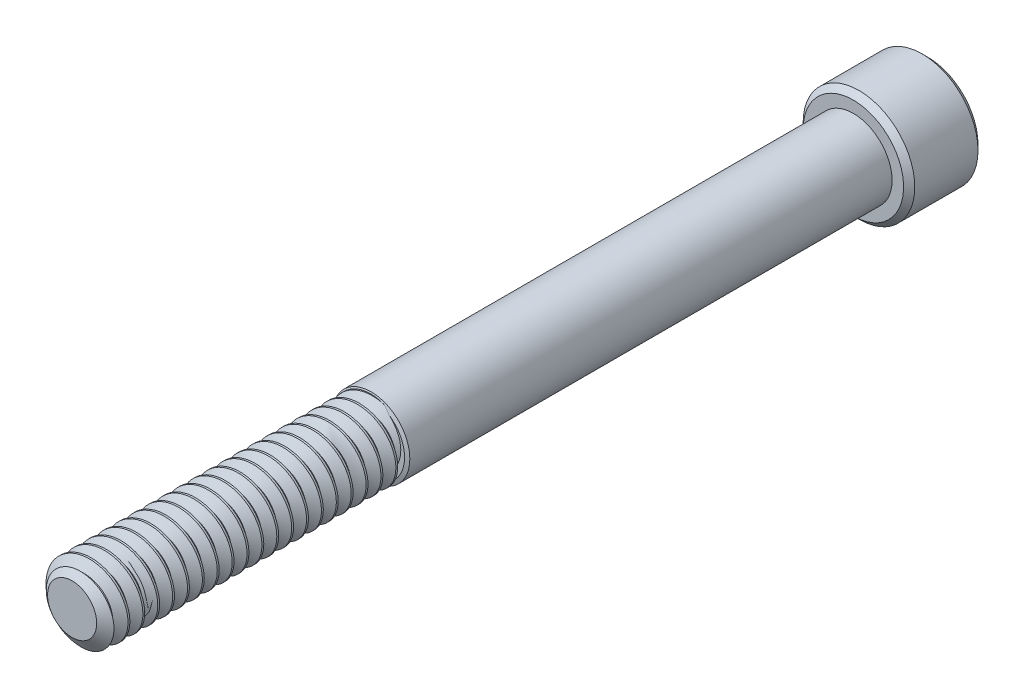
from build123d import *

# Parameters (mm, degrees)
SKETCH1_R          = 3.175
EXTRUDE1_DEPTH     = 66.675
CUT_SWEEP1_PITCH   = 1.27
SKETCH6_R          = 4.7625
EXTRUDE2_DEPTH     = 6.35
CUT_EXTRUDE1_DEPTH = 3.571875
CHAMFER1_SIZE      = 0.47625


with BuildPart() as part:
    # Sketch1 → Extrude1 (new body)
    with BuildSketch(Plane.XY):
        Circle(SKETCH1_R)
    extrude(amount=-EXTRUDE1_DEPTH)

    # Cut-Sweep1: the profile of Sketch3 profile screwed along a right-hand helix of 53.5 turns, 6 arcs to a turn; built about Z, then put on its axis
    cut_sweep1_z = Axis((0, 0, 0), (0, 0, 1))
    cut_sweep1_corners = [(3.1753, 0, -1.111423205), (2.350110803, 0, -0.635), (2.350110803, 0, -0.47625), (3.1753, 0, 0.000173205)]
    with BuildLine(mode=Mode.PRIVATE) as cut_sweep1_profile:
        Line(cut_sweep1_corners[0], cut_sweep1_corners[1])
        Line(cut_sweep1_corners[1], cut_sweep1_corners[2])
        Line(cut_sweep1_corners[2], cut_sweep1_corners[3])
        Line(cut_sweep1_corners[3], cut_sweep1_corners[0])
    cut_sweep1_cap = Face(cut_sweep1_profile.wire())
    cut_sweep1_turn_angles = [0, 30, 60, 90, 120, 150, 180, 210, 240, 270, 300, 330, 360, 390, 420, 450, 480, 510, 540, 570, 600, 630, 660, 690, 720]
    cut_sweep1_turn_weights = [1, 0.8660254037844387, 1, 0.8660254037844387, 1, 0.8660254037844387, 1, 0.8660254037844387, 1, 0.8660254037844387, 1, 0.8660254037844387, 1, 0.8660254037844387, 1, 0.8660254037844387, 1, 0.8660254037844387, 1, 0.8660254037844387, 1, 0.8660254037844387, 1, 0.8660254037844387, 1]
    cut_sweep1_turn_rails = [Edge.make_bspline([Vector(p[0], p[1], 0).rotate(cut_sweep1_z, cut_sweep1_turn_angles[k]) / cut_sweep1_turn_weights[k] + Vector(0, 0, p[2] + CUT_SWEEP1_PITCH * cut_sweep1_turn_angles[k] / 360) for k in range(25)], [0, 0, 0, 1, 1, 2, 2, 3, 3, 4, 4, 5, 5, 6, 6, 7, 7, 8, 8, 9, 9, 10, 10, 11, 11, 12, 12, 12], 2, cut_sweep1_turn_weights) for p in cut_sweep1_corners]
    cut_sweep1_turn_sides = [Face.make_surface_from_curves(cut_sweep1_turn_rails[p[0]], cut_sweep1_turn_rails[p[1]]) for p in [(0, 1), (1, 2), (2, 3), (3, 0)]]
    cut_sweep1_last_angles = [18720, 18750, 18780, 18810, 18840, 18870, 18900, 18930, 18960, 18990, 19020, 19050, 19080, 19110, 19140, 19170, 19200, 19230, 19260]
    cut_sweep1_last_weights = [1, 0.8660254037844387, 1, 0.8660254037844387, 1, 0.8660254037844387, 1, 0.8660254037844387, 1, 0.8660254037844387, 1, 0.8660254037844387, 1, 0.8660254037844387, 1, 0.8660254037844387, 1, 0.8660254037844228, 1]
    cut_sweep1_last_rails = [Edge.make_bspline([Vector(p[0], p[1], 0).rotate(cut_sweep1_z, cut_sweep1_last_angles[k]) / cut_sweep1_last_weights[k] + Vector(0, 0, p[2] + CUT_SWEEP1_PITCH * cut_sweep1_last_angles[k] / 360) for k in range(19)], [0, 0, 0, 1, 1, 2, 2, 3, 3, 4, 4, 5, 5, 6, 6, 7, 7, 8, 8, 9, 9, 9], 2, cut_sweep1_last_weights) for p in cut_sweep1_corners]
    cut_sweep1_last_sides = [Face.make_surface_from_curves(cut_sweep1_last_rails[p[0]], cut_sweep1_last_rails[p[1]]) for p in [(0, 1), (1, 2), (2, 3), (3, 0)]]
    cut_sweep1 = Plane(origin=(0, 0, 0), x_dir=(0, 1, 0), z_dir=(0, 0, -1)) * Solid(Shell([*[p.moved(Location((0, 0, 2 * CUT_SWEEP1_PITCH * i))) for i in range(26) for p in cut_sweep1_turn_sides], *cut_sweep1_last_sides, cut_sweep1_cap, cut_sweep1_cap.rotate(cut_sweep1_z, 19260).moved(Location((0, 0, CUT_SWEEP1_PITCH * 19260 / 360)))]))
    add(cut_sweep1, mode=Mode.SUBTRACT)

    # Sketch4 → Cut-Revolve1 (revolve, cut)
    with BuildSketch(Plane(origin=(0, 0, 0), x_dir=(0, 0, -1), z_dir=(1, 0, 0)), mode=Mode.PRIVATE) as cut_revolve1_sk:
        Polygon((0.755446349, 3.175), (0, 2.096110803), (0, 3.175), align=None)
    revolve(cut_revolve1_sk.sketch.rotate(Axis((0, 0, 0), (0, 0, -1)), 90), axis=Axis((0, 0, 0), (0, 0, -1)), mode=Mode.SUBTRACT)

    # Sketch5 → partially thread (revolve)
    with BuildSketch(Plane(origin=(0, 0, 0), x_dir=(0, 0, -1), z_dir=(1, 0, 0)), mode=Mode.PRIVATE) as partially_thread_sk:
        Polygon((66.675, 3.302), (25.520182971, 3.302), (25.4, 2.9718), (25.4, 0), (66.675, 0), align=None)
    revolve(partially_thread_sk.sketch.rotate(Axis((0, 0, 0), (0, 0, -1)), 90), axis=Axis((0, 0, 0), (0, 0, -1)))

    # Sketch6 → Extrude2 (add)
    with BuildSketch(Plane(origin=(0, 0, -66.675), x_dir=(-1, 0, 0), z_dir=(0, 0, -1))):
        with Locations(Location((0, 0, 0), (0, 0, 180))):
            Circle(SKETCH6_R)
    extrude(amount=EXTRUDE2_DEPTH)

    # Sketch7 → Cut-Extrude1 (cut)
    with BuildSketch(Plane(origin=(0, 0, -73.025), x_dir=(-1, 0, 0), z_dir=(0, 0, -1))):
        Polygon((0, 2.749630657), (-2.38125, 1.374815329), (-2.38125, -1.374815329), (0, -2.749630657), (2.38125, -1.374815329), (2.38125, 1.374815329), align=None)
    extrude(amount=-CUT_EXTRUDE1_DEPTH, mode=Mode.SUBTRACT)

    # Cut-Extrude2 cone 1 section (through the dimple's axis) → Cut-Extrude2 (revolve, cut)
    with BuildSketch(Plane(origin=(0, 0, -73.025), x_dir=(0, 1, 0), z_dir=(1, 0, 0))):
        Polygon((0, 0), (2.749630657, 0), (0, 2.749630657), align=None)
    revolve(axis=Axis((0, 0, -73.025), (0, 0, 1)), mode=Mode.SUBTRACT)

    # Chamfer1
    chamfer1_edges = [part.edges().sort_by_distance(p)[0] for p in [
        (-4.7625, 0, -66.675),
        (-4.7625, 0, -73.025),
    ]]
    chamfer(chamfer1_edges, length=CHAMFER1_SIZE)


solid = part.part
